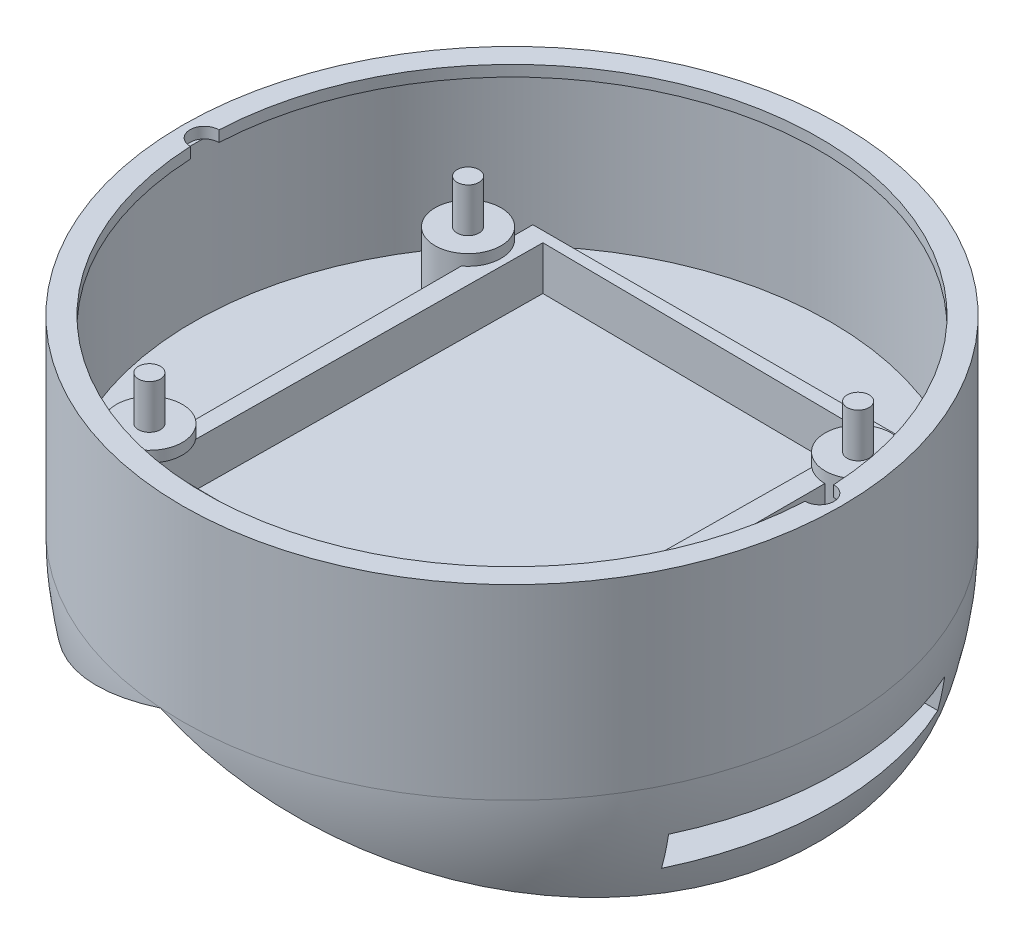
from build123d import *

# Parameters (mm, degrees)
SKETCH1_R               = 30
BOSS_EXTRUDE1_DEPTH     = 17
SKETCH2_R               = 29
CUT_EXTRUDE1_DEPTH      = 15
SKETCH3_R               = 3
BOSS_EXTRUDE5_DEPTH     = 5
REVOLVE9_ANGLE          = 20
REVOLVE13_ANGLE         = 20
CUT_EXTRUDE3_DEPTH      = 52.961524227
CUT_EXTRUDE3_DEPTH_BACK = 52.961524227
SKETCH14_W              = 25
SKETCH14_H              = 3
SKETCH16_W              = 33.683840896
SKETCH16_H              = 37
BOSS_EXTRUDE8_DEPTH     = 4
CUT_EXTRUDE4_DEPTH      = 4
SKETCH18_R              = 1
BOSS_EXTRUDE10_DEPTH    = 4
BOSS_EXTRUDE11_START    = 1
SKETCH19_R              = 29
BOSS_EXTRUDE11_DEPTH    = 1
SKETCH20_R              = 28
CUT_EXTRUDE5_DEPTH      = 1
SKETCH21_R              = 1.3
CUT_EXTRUDE19_DEPTH     = 1
SKETCH22_R              = 1.3
CUT_EXTRUDE20_DEPTH     = 1


with BuildPart() as part:
    # Sketch1 → Boss-Extrude1 (new body)
    with BuildSketch(Plane(origin=(0, 0, 0), x_dir=(1, 0, 0), z_dir=(0, 1, 0))):
        Circle(SKETCH1_R)
    extrude(amount=BOSS_EXTRUDE1_DEPTH)

    # Sketch2 → Cut-Extrude1 (cut)
    with BuildSketch(Plane(origin=(0, 17, 0), x_dir=(1, 0, 0), z_dir=(0, 1, 0))):
        Circle(SKETCH2_R)
    extrude(amount=-CUT_EXTRUDE1_DEPTH, mode=Mode.SUBTRACT)

    # Sketch3 → Boss-Extrude5 (add)
    with BuildSketch(Plane(origin=(0, 2, 0), x_dir=(1, 0, 0), z_dir=(0, 1, 0))):
        with Locations((-19, 15)):
            Circle(SKETCH3_R)
        with Locations((-18, -15)):
            Circle(SKETCH3_R)
        with Locations((17.5, -15)):
            Circle(SKETCH3_R)
        with Locations((16.5, 15)):
            Circle(SKETCH3_R)
    extrude(amount=BOSS_EXTRUDE5_DEPTH)

    # Sketch9 → Revolve9 (revolve)
    with BuildSketch(Plane.XZ):
        with BuildLine():
            Line((-2.042410935, 29.930395212), (2.042410935, -29.930395212))
            ThreePointArc((2.042410935, -29.930395212), (29.930395212, 2.042410935), (-2.042410935, 29.930395212))
        make_face()
    revolve(axis=Axis((-2.042410935, 0, 29.930395212), (0.06808036450925674, 0, -0.9976798404138909)), revolution_arc=REVOLVE9_ANGLE)

    # Sketch13 → Revolve13 (revolve)
    with BuildSketch(Plane.XZ):
        with BuildLine():
            Line((2.042410935, -29.930395212), (-2.042410935, 29.930395212))
            ThreePointArc((-2.042410935, 29.930395212), (-29.930395212, -2.042410935), (2.042410935, -29.930395212))
        make_face()
    revolve(axis=Axis((2.042410935, 0, -29.930395212), (-0.06808036450925677, 0, 0.9976798404138909)), revolution_arc=REVOLVE13_ANGLE)

    # Sketch14 → Cut-Extrude3 (cut, two sides: drawn at the far end of the back side and taken through both)
    with BuildSketch(Plane(origin=(0, 0, 0), x_dir=(0, 0, -1), z_dir=(1, 0, 0)).offset(-CUT_EXTRUDE3_DEPTH_BACK)):
        with Locations((-0.14208972, -5.617127886)):
            Rectangle(SKETCH14_W, SKETCH14_H)
    extrude(amount=CUT_EXTRUDE3_DEPTH + CUT_EXTRUDE3_DEPTH_BACK, mode=Mode.SUBTRACT)

    # Sketch16 → Boss-Extrude8 (add)
    with BuildSketch(Plane(origin=(0, 2, 0), x_dir=(1, 0, 0), z_dir=(0, 1, 0))):
        with Locations((-0.366579768, 0.606295092)):
            Rectangle(SKETCH16_W, SKETCH16_H)
    extrude(amount=BOSS_EXTRUDE8_DEPTH)

    # Sketch17 → Cut-Extrude4 (cut)
    with BuildSketch(Plane(origin=(0, 6, 0), x_dir=(1, 0, 0), z_dir=(0, 1, 0))):
        Polygon((-15.33390103, 18.145330558), (-15.681200182, -16.903461953), (14.317327096, -17.200717931), (14.664626249, 17.84807458), align=None)
    extrude(amount=-CUT_EXTRUDE4_DEPTH, mode=Mode.SUBTRACT)

    # Sketch18 → Boss-Extrude10 (add)
    with BuildSketch(Plane(origin=(0, 7, 0), x_dir=(1, 0, 0), z_dir=(0, 1, 0))):
        with Locations((16.5, 15)):
            Circle(SKETCH18_R)
        with Locations((17.5, -15)):
            Circle(SKETCH18_R)
        with Locations((-18, -15)):
            Circle(SKETCH18_R)
        with Locations((-19, 15)):
            Circle(SKETCH18_R)
    extrude(amount=BOSS_EXTRUDE10_DEPTH)

    # Sketch19 → Boss-Extrude11 (add)
    with BuildSketch(Plane(origin=(0, 16, 0), x_dir=(1, 0, 0), z_dir=(0, 1, 0)).offset(BOSS_EXTRUDE11_START)):
        Circle(SKETCH19_R)
    extrude(amount=-BOSS_EXTRUDE11_DEPTH)

    # Sketch20 → Cut-Extrude5 (cut)
    with BuildSketch(Plane(origin=(0, 17, 0), x_dir=(1, 0, 0), z_dir=(0, 1, 0))):
        Circle(SKETCH20_R)
    extrude(amount=-CUT_EXTRUDE5_DEPTH, mode=Mode.SUBTRACT)

    # Sketch21 → Cut-Extrude19 (cut)
    with BuildSketch(Plane(origin=(0, 17, 0), x_dir=(1, 0, 0), z_dir=(0, 1, 0))):
        with Locations((28, 0)):
            Circle(SKETCH21_R)
    extrude(amount=-CUT_EXTRUDE19_DEPTH, mode=Mode.SUBTRACT)

    # Sketch22 → Cut-Extrude20 (cut)
    with BuildSketch(Plane(origin=(0, 17, 0), x_dir=(1, 0, 0), z_dir=(0, 1, 0))):
        with Locations((-28, 0)):
            Circle(SKETCH22_R)
    extrude(amount=-CUT_EXTRUDE20_DEPTH, mode=Mode.SUBTRACT)


solid = part.part
